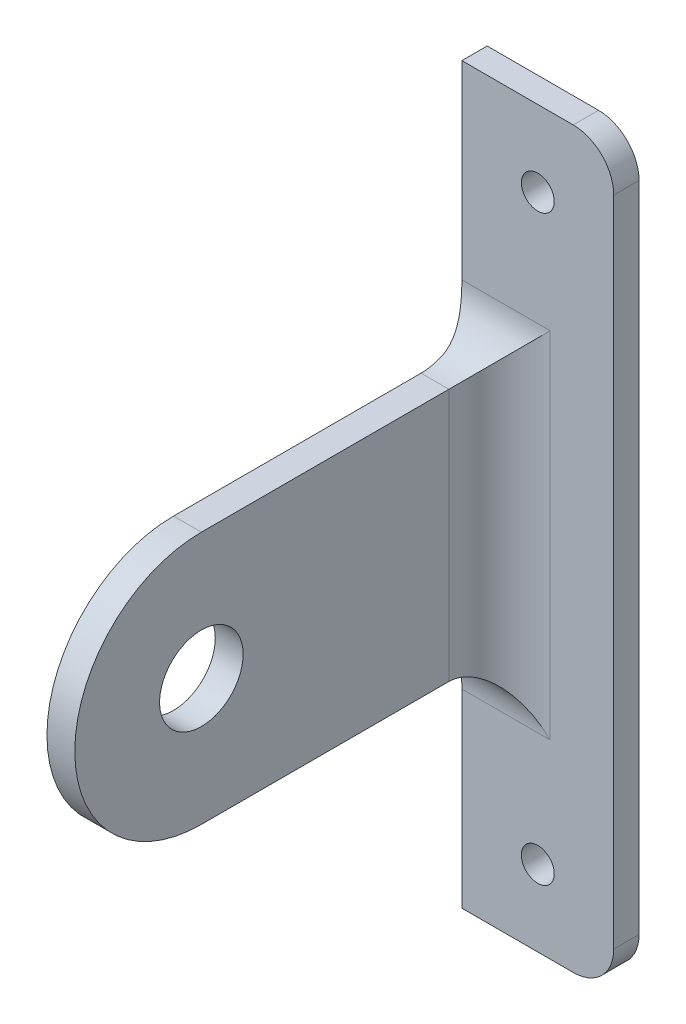
from build123d import *

# Parameters (mm, degrees)
SKETCH1_R               = 4.125
BOSS_EXTRUDE1_DEPTH     = 2.75
BOSS_EXTRUDE4_DEPTH     = 2.5
CUT_EXTRUDE2_REACH      = 80.314
SKETCH7_W               = 7
SKETCH7_H               = 16.5
SKETCH7_W_2             = 16
SKETCH7_H_2             = 8
CUT_EXTRUDE3_REACH      = 82.041
SKETCH9_W               = 2.75
SKETCH9_H               = 22.388822383
SKETCH8_W               = 2.75
SKETCH8_H               = 27.825
BOSS_EXTRUDE5_DEPTH     = 12.5
FILLET2_R               = 1
FILLET3_R               = 4
CUT_EXTRUDE4_DEPTH      = 74.103052287
CUT_EXTRUDE4_DEPTH_BACK = 74.103052287
SKETCH10_W              = 78.235731334
SKETCH10_H              = 6.290045588
SKETCH11_W              = 15
SKETCH11_H              = 2.5
BOSS_EXTRUDE6_DEPTH     = 12.5
BOSS_EXTRUDE7_DEPTH     = 2.5
SKETCH14_R              = 1.625
CUT_EXTRUDE5_DEPTH      = 2.5
FILLET4_R               = 5


with BuildPart() as part:
    # Sketch1 → Boss-Extrude1 (new body)
    with BuildSketch(Plane(origin=(0, 0, 0), x_dir=(0, 0, -1), z_dir=(1, 0, 0))):
        with BuildLine():
            Line((0, 12.5), (34.45, 12.5))
            Line((34.45, 12.5), (34.45, -12.5))
            Line((34.45, -12.5), (0, -12.5))
            ThreePointArc((0, -12.5), (-12.5, 0), (0, 12.5))
        make_face()
        Circle(SKETCH1_R, mode=Mode.SUBTRACT)
    extrude(amount=BOSS_EXTRUDE1_DEPTH)

    # Sketch6 → Boss-Extrude4 (add)
    with BuildSketch(Plane(origin=(0, 0, -34.45), x_dir=(-1, 0, 0), z_dir=(0, 0, -1))):
        Polygon((-8.812505246, 36.25), (53.321583376, 36.25), (53.321583376, -36.25), (6.25, -36.25), (-19.178416624, -36.25), (-19.178416624, 36.25), align=None)
    extrude(amount=-BOSS_EXTRUDE4_DEPTH)

    # Sketch7 → Cut-Extrude2 (cut, up to next)
    with BuildSketch(Plane.XY.offset(-31.95), mode=Mode.PRIVATE) as cut_extrude2_sk1:
        with Locations((-1.711858899, -11.632438111)):
            Rectangle(SKETCH7_W, SKETCH7_H)
    cut_extrude2_tool1 = extrude(cut_extrude2_sk1.sketch, amount=-CUT_EXTRUDE2_REACH, mode=Mode.PRIVATE) & part.part
    # Sketch7 → Cut-Extrude2 (cut, up to next)
    with BuildSketch(Plane.XY.offset(-31.95), mode=Mode.PRIVATE) as cut_extrude2_sk2:
        with Locations((-16.5, 0)):
            Rectangle(SKETCH7_W_2, SKETCH7_H_2)
    cut_extrude2_tool2 = extrude(cut_extrude2_sk2.sketch, amount=-CUT_EXTRUDE2_REACH, mode=Mode.PRIVATE) & part.part
    add(cut_extrude2_tool1.solids().sort_by_distance((-1.711859, -11.632438, -31.95))[0], mode=Mode.SUBTRACT)
    add(cut_extrude2_tool2.solids().sort_by_distance((-16.5, 0, -31.95))[0], mode=Mode.SUBTRACT)

    # Sketch9 → Cut-Extrude3 (cut, up to next)
    with BuildSketch(Plane.XZ.offset(12.5), mode=Mode.PRIVATE) as cut_extrude3_sk1:
        with Locations((1.375, -20.755588809)):
            Rectangle(SKETCH9_W, SKETCH9_H)
    cut_extrude3_tool1 = extrude(cut_extrude3_sk1.sketch, amount=-CUT_EXTRUDE3_REACH, mode=Mode.PRIVATE) & part.part
    add(cut_extrude3_tool1.solids().sort_by_distance((1.375, -12.5, -20.755589))[0], mode=Mode.SUBTRACT)


with BuildPart() as cut_extrude3_piece_1:
    # of the separate pieces the step leaves, piece 1, a body of its own (cut_extrude3_pieces)
    add(part.part.solids().sort_by_distance((-53.321583376, 36.25, -31.95))[0])



with BuildPart() as cut_extrude3_piece_2:
    # of the separate pieces the step leaves, piece 2, a body of its own (cut_extrude3_pieces)
    add(part.part.solids().sort_by_distance((0, 12.5, 0))[0])


with BuildPart() as cut_extrude3_piece_1_1:
    add(cut_extrude3_piece_1.part)

    add(cut_extrude3_piece_2.part)  # Boss-Extrude5 merges Cut-Extrude3 piece 2
    # Sketch8 → Boss-Extrude5 (add, symmetric)
    with BuildSketch(Plane(origin=(0, 0, 0), x_dir=(1, 0, 0), z_dir=(0, 1, 0))):
        with Locations((1.375, 18.0375)):
            Rectangle(SKETCH8_W, SKETCH8_H)
    extrude(amount=BOSS_EXTRUDE5_DEPTH, both=True)

    # Fillet2
    fillet2_edges = [cut_extrude3_piece_1_1.edges().sort_by_distance(p)[0] for p in [
        (-8.5, 4, -33.2),
        (-8.5, -4, -33.2),
        (-24.5, -4, -33.2),
        (-24.5, 4, -33.2),
        (-5.211858899, -19.882438111, -33.2),
        (-5.211858899, -3.382438111, -33.2),
        (1.788141101, -3.382438111, -33.2),
        (1.788141101, -19.882438111, -33.2),
    ]]
    fillet(fillet2_edges, radius=FILLET2_R)

    # Fillet3
    fillet3_edges = [cut_extrude3_piece_1_1.edges().sort_by_distance(p)[0] for p in [
        (19.178416624, 36.25, -33.2),
        (-53.321583376, 36.25, -33.2),
        (-53.321583376, -36.25, -33.2),
        (19.178416624, -36.25, -33.2),
    ]]
    fillet(fillet3_edges, radius=FILLET3_R)

    # Sketch10 → Cut-Extrude4 (cut, two sides: drawn at the far end of the back side and taken through both)
    with BuildSketch(Plane(origin=(0, 0, 0), x_dir=(1, 0, 0), z_dir=(0, 1, 0)).offset(-CUT_EXTRUDE4_DEPTH_BACK)):
        with Locations((-17.391929865, 35.095022794)):
            Rectangle(SKETCH10_W, SKETCH10_H)
    extrude(amount=CUT_EXTRUDE4_DEPTH + CUT_EXTRUDE4_DEPTH_BACK, mode=Mode.SUBTRACT)

    # Sketch11 → Boss-Extrude6 (add, symmetric)
    with BuildSketch(Plane(origin=(0, 0, 0), x_dir=(1, 0, 0), z_dir=(0, 1, 0))):
        with Locations((6.53, 30.7)):
            Rectangle(SKETCH11_W, SKETCH11_H)
    boss_extrude6 = extrude(amount=BOSS_EXTRUDE6_DEPTH, both=True)

    # Sketch13 → Boss-Extrude7 (add)
    with BuildSketch(Plane(origin=(0, 0, -31.95), x_dir=(-1, 0, 0), z_dir=(0, 0, -1))):
        with BuildLine():
            Line((-14.03, 12.5), (0.97, 12.5))
            Line((0.97, 12.5), (0.97, 36.25))
            Line((0.97, 36.25), (-10.03, 36.25))
            ThreePointArc((-10.03, 36.25), (-12.858427125, 35.078427125), (-14.03, 32.25))
            Line((-14.03, 32.25), (-14.03, 12.5))
        make_face()
    boss_extrude7 = extrude(amount=-BOSS_EXTRUDE7_DEPTH)

    # Mirror1: Boss-Extrude6, Boss-Extrude7 across plane
    add(boss_extrude6.mirror(Plane.ZX))
    add(boss_extrude7.mirror(Plane.ZX))

    # Sketch14 → Cut-Extrude5 (cut)
    with BuildSketch(Plane(origin=(0, 0, -31.95), x_dir=(-1, 0, 0), z_dir=(0, 0, -1))):
        with Locations((-6.53, 28.75)):
            Circle(SKETCH14_R)
    cut_extrude5 = extrude(amount=-CUT_EXTRUDE5_DEPTH, mode=Mode.SUBTRACT)

    # Mirror2: Cut-Extrude5 across plane
    add(cut_extrude5.mirror(Plane.ZX), mode=Mode.SUBTRACT)

    # Fillet4
    # the kernel refuses this fillet: 5 mm, written as the material it adds along each edge
    with BuildSketch(Plane(origin=(2.75, -12.5, -29.45), x_dir=(1, 0, 0), z_dir=(0, 1, 0))) as fillet4_piece_1:
        with BuildLine():
            CenterArc((FILLET4_R, -FILLET4_R), FILLET4_R, 90, 90)
            Line((0, -FILLET4_R), (-FILLET4_R * 0.02, -FILLET4_R))
            Line((-FILLET4_R * 0.02, -FILLET4_R), (-FILLET4_R * 0.02, FILLET4_R * 0.02))
            Line((-FILLET4_R * 0.02, FILLET4_R * 0.02), (FILLET4_R, FILLET4_R * 0.02))
            Line((FILLET4_R, FILLET4_R * 0.02), (FILLET4_R, 0))
        make_face()
    extrude(amount=25)
    with BuildSketch(Plane(origin=(0, -12.5, -29.45), x_dir=(-1, 0, 0), z_dir=(0, 1, 0))) as fillet4_piece_2:
        with BuildLine():
            CenterArc((5, 2.959577673), FILLET4_R, 180, 36.293058493)
            Line((0, 2.959577673), (-0.1, 2.959577673))
            Line((-0.1, 2.959577673), (-0.1, 0))
            Line((-0.1, 0), (0, -0.1))
            ThreePointArc((0, -0.1), (0.485, -0.1), (0.8894, -0.059191553))
            Line((0.8894, -0.059191553), (0.97, 0))
        make_face()
    extrude(amount=25)
    with BuildSketch(Plane(origin=(2.75, 12.5, -29.45), x_dir=(0, 0, 1), z_dir=(-1, 0, 0)), Plane(origin=(2.75, -12.5, -29.45), x_dir=(0, -1, 0), z_dir=(-1, 0, 0))) as fillet4_piece_3:
        with BuildLine():
            CenterArc((FILLET4_R, FILLET4_R), FILLET4_R, 180, 90)
            Line((0, FILLET4_R), (-FILLET4_R * 0.02, FILLET4_R))
            Line((-FILLET4_R * 0.02, FILLET4_R), (-FILLET4_R * 0.02, -FILLET4_R * 0.02))
            Line((-FILLET4_R * 0.02, -FILLET4_R * 0.02), (FILLET4_R, -FILLET4_R * 0.02))
            Line((FILLET4_R, -FILLET4_R * 0.02), (FILLET4_R, 0))
        make_face()
    extrude(amount=2.75)
    with BuildSketch(Plane(origin=(2.75, -25, -29.45), x_dir=(1, 0, 0), z_dir=(0, 1, 0))) as fillet4_piece_4a_section:
        with BuildLine():
            CenterArc((FILLET4_R, -FILLET4_R), FILLET4_R, 90, 90)
            Line((0, -FILLET4_R), (-FILLET4_R * 0.02, -FILLET4_R))
            Line((-FILLET4_R * 0.02, -FILLET4_R), (-FILLET4_R * 0.02, FILLET4_R * 0.02))
            Line((-FILLET4_R * 0.02, FILLET4_R * 0.02), (FILLET4_R, FILLET4_R * 0.02))
            Line((FILLET4_R, FILLET4_R * 0.02), (FILLET4_R, 0))
        make_face()
    fillet4_piece_4a = extrude(amount=37.5, mode=Mode.PRIVATE)
    fillet4_piece_4a = split(fillet4_piece_4a, bisect_by=Plane(origin=(3.881975571, -12.5, -28.318024429), z_dir=(0, -1, 0)), keep=Keep.TOP, mode=Mode.PRIVATE)
    with BuildSketch(Plane(origin=(15.25, -12.5, -29.45), x_dir=(0, -1, 0), z_dir=(-1, 0, 0))) as fillet4_piece_4b_section:
        with BuildLine():
            CenterArc((FILLET4_R, FILLET4_R), FILLET4_R, 180, 90)
            Line((0, FILLET4_R), (-FILLET4_R * 0.02, FILLET4_R))
            Line((-FILLET4_R * 0.02, FILLET4_R), (-FILLET4_R * 0.02, -FILLET4_R * 0.02))
            Line((-FILLET4_R * 0.02, -FILLET4_R * 0.02), (FILLET4_R, -FILLET4_R * 0.02))
            Line((FILLET4_R, -FILLET4_R * 0.02), (FILLET4_R, 0))
        make_face()
    fillet4_piece_4b = extrude(amount=15.25, mode=Mode.PRIVATE)
    fillet4_piece_4b = split(fillet4_piece_4b, bisect_by=Plane(origin=(14.03, -13.631975571, -28.318024429), z_dir=(-1, 0, 0)), keep=Keep.TOP, mode=Mode.PRIVATE)
    fillet4_piece_4b = split(fillet4_piece_4b, bisect_by=Plane(origin=(2.75, -13.631975571, -28.318024429), z_dir=(1, 0, 0)), keep=Keep.TOP, mode=Mode.PRIVATE)
    fillet4_piece_4 = fillet4_piece_4a & fillet4_piece_4b
    add(fillet4_piece_4)
    with BuildSketch(Plane(origin=(15.25, 12.5, -29.45), x_dir=(0, 0, 1), z_dir=(-1, 0, 0))) as fillet4_piece_5a_section:
        with BuildLine():
            CenterArc((FILLET4_R, FILLET4_R), FILLET4_R, 180, 90)
            Line((0, FILLET4_R), (-FILLET4_R * 0.02, FILLET4_R))
            Line((-FILLET4_R * 0.02, FILLET4_R), (-FILLET4_R * 0.02, -FILLET4_R * 0.02))
            Line((-FILLET4_R * 0.02, -FILLET4_R * 0.02), (FILLET4_R, -FILLET4_R * 0.02))
            Line((FILLET4_R, -FILLET4_R * 0.02), (FILLET4_R, 0))
        make_face()
    fillet4_piece_5a = extrude(amount=15.25, mode=Mode.PRIVATE)
    fillet4_piece_5a = split(fillet4_piece_5a, bisect_by=Plane(origin=(2.75, 13.631975571, -28.318024429), z_dir=(1, 0, 0)), keep=Keep.TOP, mode=Mode.PRIVATE)
    fillet4_piece_5a = split(fillet4_piece_5a, bisect_by=Plane(origin=(14.03, 13.631975571, -28.318024429), z_dir=(-1, 0, 0)), keep=Keep.TOP, mode=Mode.PRIVATE)
    with BuildSketch(Plane(origin=(2.75, -12.5, -29.45), x_dir=(1, 0, 0), z_dir=(0, 1, 0))) as fillet4_piece_5b_section:
        with BuildLine():
            CenterArc((FILLET4_R, -FILLET4_R), FILLET4_R, 90, 90)
            Line((0, -FILLET4_R), (-FILLET4_R * 0.02, -FILLET4_R))
            Line((-FILLET4_R * 0.02, -FILLET4_R), (-FILLET4_R * 0.02, FILLET4_R * 0.02))
            Line((-FILLET4_R * 0.02, FILLET4_R * 0.02), (FILLET4_R, FILLET4_R * 0.02))
            Line((FILLET4_R, FILLET4_R * 0.02), (FILLET4_R, 0))
        make_face()
    fillet4_piece_5b = extrude(amount=37.5, mode=Mode.PRIVATE)
    fillet4_piece_5b = split(fillet4_piece_5b, bisect_by=Plane(origin=(3.881975571, 12.5, -28.318024429), z_dir=(0, 1, 0)), keep=Keep.TOP, mode=Mode.PRIVATE)
    fillet4_piece_5 = fillet4_piece_5a & fillet4_piece_5b
    add(fillet4_piece_5)
    with BuildSketch(Plane(origin=(2.75, -12.5, -29.45), x_dir=(0, -1, 0), z_dir=(-1, 0, 0))) as fillet4_piece_6a_section:
        with BuildLine():
            CenterArc((FILLET4_R, FILLET4_R), FILLET4_R, 180, 90)
            Line((0, FILLET4_R), (-FILLET4_R * 0.02, FILLET4_R))
            Line((-FILLET4_R * 0.02, FILLET4_R), (-FILLET4_R * 0.02, -FILLET4_R * 0.02))
            Line((-FILLET4_R * 0.02, -FILLET4_R * 0.02), (FILLET4_R, -FILLET4_R * 0.02))
            Line((FILLET4_R, -FILLET4_R * 0.02), (FILLET4_R, 0))
        make_face()
    fillet4_piece_6a = extrude(amount=15.25, mode=Mode.PRIVATE)
    fillet4_piece_6a = split(fillet4_piece_6a, bisect_by=Plane(origin=(-0.97, -13.631975571, -28.318024429), z_dir=(1, 0, 0)), keep=Keep.TOP, mode=Mode.PRIVATE)
    fillet4_piece_6a = split(fillet4_piece_6a, bisect_by=Plane(origin=(0, -13.631975571, -28.318024429), z_dir=(-1, 0, 0)), keep=Keep.TOP, mode=Mode.PRIVATE)
    with BuildSketch(Plane(origin=(0, -19.898944181, -29.45), x_dir=(-1, 0, 0), z_dir=(0, 1, 0))) as fillet4_piece_6b_section:
        with BuildLine():
            CenterArc((5, 2.959577673), FILLET4_R, 180, 36.293058493)
            Line((0, 2.959577673), (-0.1, 2.959577673))
            Line((-0.1, 2.959577673), (-0.1, 0))
            Line((-0.1, 0), (0, -0.1))
            ThreePointArc((0, -0.1), (0.485, -0.1), (0.8894, -0.059191553))
            Line((0.8894, -0.059191553), (0.97, 0))
        make_face()
    fillet4_piece_6b = extrude(amount=32.398944181, mode=Mode.PRIVATE)
    fillet4_piece_6b = split(fillet4_piece_6b, bisect_by=Plane(origin=(-0.217435867, -12.5, -28.607978011), z_dir=(0, -1, 0)), keep=Keep.TOP, mode=Mode.PRIVATE)
    fillet4_piece_6 = fillet4_piece_6a & fillet4_piece_6b
    add(fillet4_piece_6)
    with BuildSketch(Plane(origin=(2.75, 12.5, -29.45), x_dir=(0, 0, 1), z_dir=(-1, 0, 0))) as fillet4_piece_7a_section:
        with BuildLine():
            CenterArc((FILLET4_R, FILLET4_R), FILLET4_R, 180, 90)
            Line((0, FILLET4_R), (-FILLET4_R * 0.02, FILLET4_R))
            Line((-FILLET4_R * 0.02, FILLET4_R), (-FILLET4_R * 0.02, -FILLET4_R * 0.02))
            Line((-FILLET4_R * 0.02, -FILLET4_R * 0.02), (FILLET4_R, -FILLET4_R * 0.02))
            Line((FILLET4_R, -FILLET4_R * 0.02), (FILLET4_R, 0))
        make_face()
    fillet4_piece_7a = extrude(amount=15.25, mode=Mode.PRIVATE)
    fillet4_piece_7a = split(fillet4_piece_7a, bisect_by=Plane(origin=(0, 13.631975571, -28.318024429), z_dir=(-1, 0, 0)), keep=Keep.TOP, mode=Mode.PRIVATE)
    fillet4_piece_7a = split(fillet4_piece_7a, bisect_by=Plane(origin=(-0.97, 13.631975571, -28.318024429), z_dir=(1, 0, 0)), keep=Keep.TOP, mode=Mode.PRIVATE)
    with BuildSketch(Plane(origin=(0, -12.5, -29.45), x_dir=(-1, 0, 0), z_dir=(0, 1, 0))) as fillet4_piece_7b_section:
        with BuildLine():
            CenterArc((5, 2.959577673), FILLET4_R, 180, 36.293058493)
            Line((0, 2.959577673), (-0.1, 2.959577673))
            Line((-0.1, 2.959577673), (-0.1, 0))
            Line((-0.1, 0), (0, -0.1))
            ThreePointArc((0, -0.1), (0.485, -0.1), (0.8894, -0.059191553))
            Line((0.8894, -0.059191553), (0.97, 0))
        make_face()
    fillet4_piece_7b = extrude(amount=32.398944181, mode=Mode.PRIVATE)
    fillet4_piece_7b = split(fillet4_piece_7b, bisect_by=Plane(origin=(-0.217435867, 12.5, -28.607978011), z_dir=(0, 1, 0)), keep=Keep.TOP, mode=Mode.PRIVATE)
    fillet4_piece_7 = fillet4_piece_7a & fillet4_piece_7b
    add(fillet4_piece_7)


solid = cut_extrude3_piece_1_1.part
